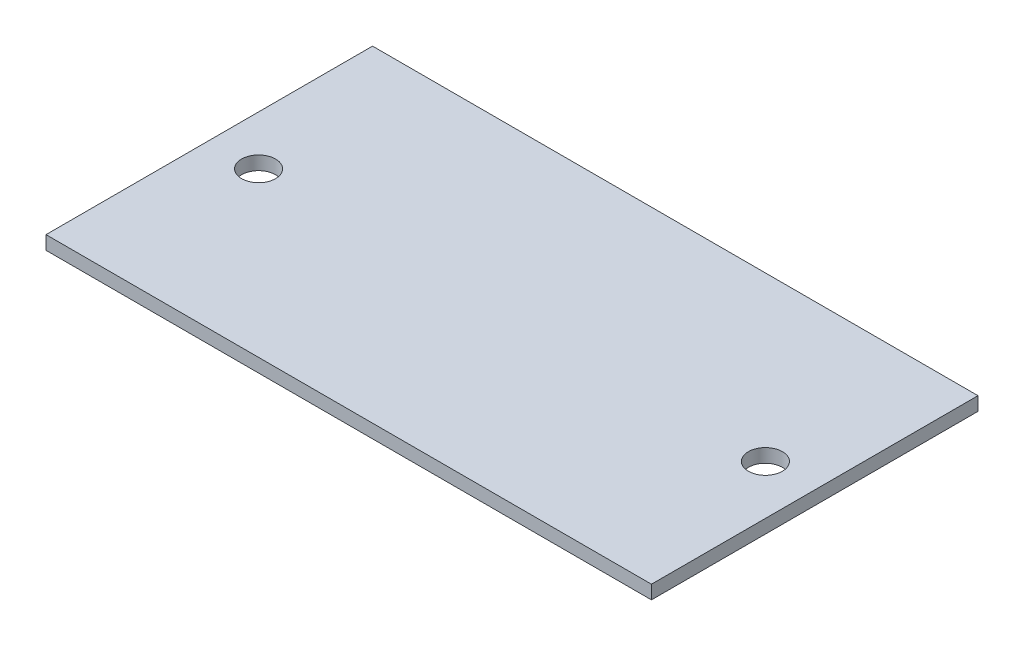
from build123d import *

# Parameters (mm, degrees)
SKETCH1_W           = 44.5
SKETCH1_H           = 24
SKETCH1_R           = 1.25
BOSS_EXTRUDE1_DEPTH = 1


with BuildPart() as part:
    # Sketch1 → Boss-Extrude1 (new body)
    with BuildSketch(Plane(origin=(0, 0, 0), x_dir=(1, 0, 0), z_dir=(0, 1, 0))):
        Rectangle(SKETCH1_W, SKETCH1_H)
        with Locations((18.625, 0)):
            Circle(SKETCH1_R, mode=Mode.SUBTRACT)
        with Locations((-18.625, 0)):
            Circle(SKETCH1_R, mode=Mode.SUBTRACT)
    extrude(amount=BOSS_EXTRUDE1_DEPTH)


solid = part.part
